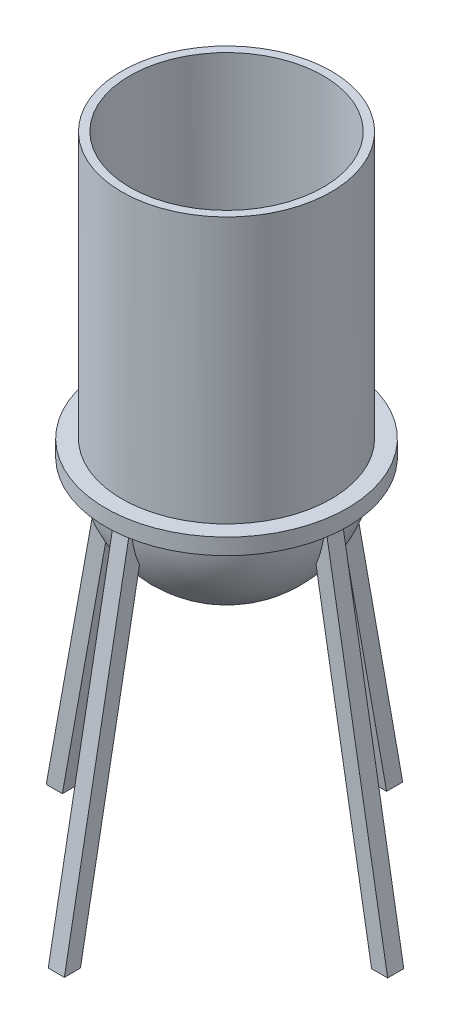
from build123d import *
from build123d.topology import SkipClean

# Parameters (mm, degrees)
SKETCH1_R              = 330.20000000000005
BOSS_EXTRUDE1_DEPTH    = 889
SKETCH2_R              = 304.8
CUT_EXTRUDE1_DEPTH     = 876.3
SKETCH5_R              = 381
BOSS_EXTRUDE2_DEPTH    = 50.8
CUT_EXTRUDE2_START     = -1e-07
CUT_EXTRUDE2_OUTLINE_R = 304.8
CUT_EXTRUDE2_DEPTH     = 889.0000002


with BuildPart() as part:
    # Sketch1 → Boss-Extrude1 (new body)
    with BuildSketch(Plane(origin=(0, 0, 0), x_dir=(1, 0, 0), z_dir=(0, 1, 0))):
        with Locations(Location((0, 0, 0), (0, 0, 270))):
            Circle(SKETCH1_R)
    extrude(amount=BOSS_EXTRUDE1_DEPTH)

    # Sketch2 → Cut-Extrude1 (cut)
    with BuildSketch(Plane(origin=(0, 889, 0), x_dir=(1, 0, 0), z_dir=(0, 1, 0))):
        with Locations(Location((0, 0, 0), (0, 0, 270))):
            Circle(SKETCH2_R)
    extrude(amount=-CUT_EXTRUDE1_DEPTH, mode=Mode.SUBTRACT)

    # Sketch5 → Boss-Extrude2 (add)
    with BuildSketch(Plane.XZ):
        with Locations(Location((0, 0, 0), (0, 0, 270))):
            Circle(SKETCH5_R)
    extrude(amount=-BOSS_EXTRUDE2_DEPTH)

    # Sketch8 → Revolve1 (revolve)
    with BuildSketch(Plane.XZ):
        with BuildLine():
            Line((330.2, 0), (-330.2, 0))
            ThreePointArc((-330.2, 0), (2.022e-14, 330.2), (330.2, 0))
        make_face()
    revolve(axis=Axis((330.2, 0, 0), (-1, 0, 0)))

    # Sketch11 → Cut-Revolve1 (revolve, cut)
    with BuildSketch(Plane(origin=(0, 0, 0), x_dir=(1, 0, 0), z_dir=(0, 1, 0))):
        with BuildLine():
            Line((304.80000000000007, 0), (-304.80000000000007, 0))
            ThreePointArc((-304.80000000000007, 0), (1.866e-14, 304.80000000000007), (304.80000000000007, 0))
        make_face()
    revolve(axis=Axis((304.80000000000007, 0, 0), (-1, 0, 0)), mode=Mode.SUBTRACT)

    # Cut-Extrude2: read off the stored shape, not the designer's step
    # Cut-Extrude2 outline → Cut-Extrude2 (cut)
    with SkipClean():  # the faces are left unmerged after this step: merging them gives an invalid solid
        with BuildSketch(Plane(origin=(0, 0, 0), x_dir=(1, 0, 0), z_dir=(0, 1, 0)).offset(CUT_EXTRUDE2_START)):
            Circle(CUT_EXTRUDE2_OUTLINE_R)
        extrude(amount=CUT_EXTRUDE2_DEPTH, mode=Mode.SUBTRACT)

    # Sketch14 → Loft3 section 0
    with SkipClean():  # the faces are left unmerged after this step: merging them gives an invalid solid
        with BuildSketch(Plane(origin=(0, 0, 0), x_dir=(1, 0, 0), z_dir=(0, 1, 0))):
            with BuildLine():
                Line((-22.260323000361307, -330.2), (28.53967699963869, -330.2))
                Line((28.53967699963869, -330.2), (28.53967699963869, -279.4))
                Line((28.53967699963869, -279.4), (-22.260323000361307, -279.4))
                Line((-22.260323000361307, -279.4), (-22.260323000361307, -330.2))
            make_face()
        # Sketch17 → Loft3 section 1
        with BuildSketch(Plane(origin=(0, -1143, 0), x_dir=(1, 0, 0), z_dir=(0, 1, 0))):
            with BuildLine():
                Line((-28.71955564169997, -533.4000000000001), (22.08044435830003, -533.4000000000001))
                Line((22.08044435830003, -533.4000000000001), (22.080444358300024, -482.6))
                Line((22.080444358300024, -482.6), (-28.71955564169998, -482.6))
                Line((-28.71955564169998, -482.6), (-28.71955564169997, -533.4000000000001))
            make_face()
        loft()

    # Sketch14<7> → Loft4 section 0
    with SkipClean():  # the faces are left unmerged after this step: merging them gives an invalid solid
        with BuildSketch(Plane(origin=(0, 0, 0), x_dir=(1, 0, 0), z_dir=(0, 1, 0))):
            with BuildLine():
                Line((279.4, -19.993284341920333), (330.2, -19.993284341920333))
                Line((330.2, -19.993284341920333), (330.2, 30.806715658079664))
                Line((330.2, 30.806715658079664), (279.4, 30.806715658079664))
                Line((279.4, 30.806715658079664), (279.4, -19.993284341920333))
            make_face()
        # Sketch17<4> → Loft4 section 1
        with BuildSketch(Plane(origin=(0, -1143, 0), x_dir=(1, 0, 0), z_dir=(0, 1, 0))):
            with BuildLine():
                Line((482.5999999999999, -25.4), (533.3999999999999, -25.4))
                Line((533.3999999999999, -25.4), (533.3999999999999, 25.4))
                Line((533.3999999999999, 25.4), (482.5999999999999, 25.4))
                Line((482.5999999999999, 25.4), (482.5999999999999, -25.4))
            make_face()
        loft()

    # Sketch14<8> → Loft5 section 0
    with SkipClean():  # the faces are left unmerged after this step: merging them gives an invalid solid
        with BuildSketch(Plane(origin=(0, 0, 0), x_dir=(1, 0, 0), z_dir=(0, 1, 0))):
            with BuildLine():
                Line((-28.539676999638676, 279.4), (22.260323000361325, 279.4))
                Line((22.260323000361325, 279.4), (22.26032300036131, 330.2))
                Line((22.26032300036131, 330.2), (-28.539676999638687, 330.2))
                Line((-28.539676999638687, 330.2), (-28.539676999638676, 279.4))
            make_face()
        # Sketch17<5> → Loft5 section 1
        with BuildSketch(Plane(origin=(0, -1143, 0), x_dir=(1, 0, 0), z_dir=(0, 1, 0))):
            with BuildLine():
                Line((-28.71955564169995, 482.59999999999997), (22.080444358300046, 482.59999999999997))
                Line((22.080444358300046, 482.59999999999997), (22.08044435830004, 533.4))
                Line((22.08044435830004, 533.4), (-28.71955564169996, 533.4))
                Line((-28.71955564169996, 533.4), (-28.71955564169995, 482.59999999999997))
            make_face()
        loft()

    # Sketch17<6> → Loft6 section 0
    with SkipClean():  # the faces are left unmerged after this step: merging them gives an invalid solid
        with BuildSketch(Plane(origin=(0, -1143, 0), x_dir=(1, 0, 0), z_dir=(0, 1, 0))):
            with BuildLine():
                Line((-482.59999999999997, -35.064827171702525), (-533.4, -35.06482717170253))
                Line((-533.4, -35.06482717170253), (-533.4, 15.735172828297465))
                Line((-533.4, 15.735172828297465), (-482.59999999999997, 15.73517282829747))
                Line((-482.59999999999997, 15.73517282829747), (-482.59999999999997, -35.064827171702525))
            make_face()
        # Sketch14<9> → Loft6 section 1
        with BuildSketch(Plane(origin=(0, 0, 0), x_dir=(1, 0, 0), z_dir=(0, 1, 0))):
            with BuildLine():
                Line((-330.20000000000005, -30.75867207748477), (-279.40000000000003, -30.75867207748477))
                Line((-279.40000000000003, -30.75867207748477), (-279.40000000000003, 20.041327922515226))
                Line((-279.40000000000003, 20.041327922515226), (-330.20000000000005, 20.041327922515226))
                Line((-330.20000000000005, 20.041327922515226), (-330.20000000000005, -30.75867207748477))
            make_face()
        loft()


solid = part.part
